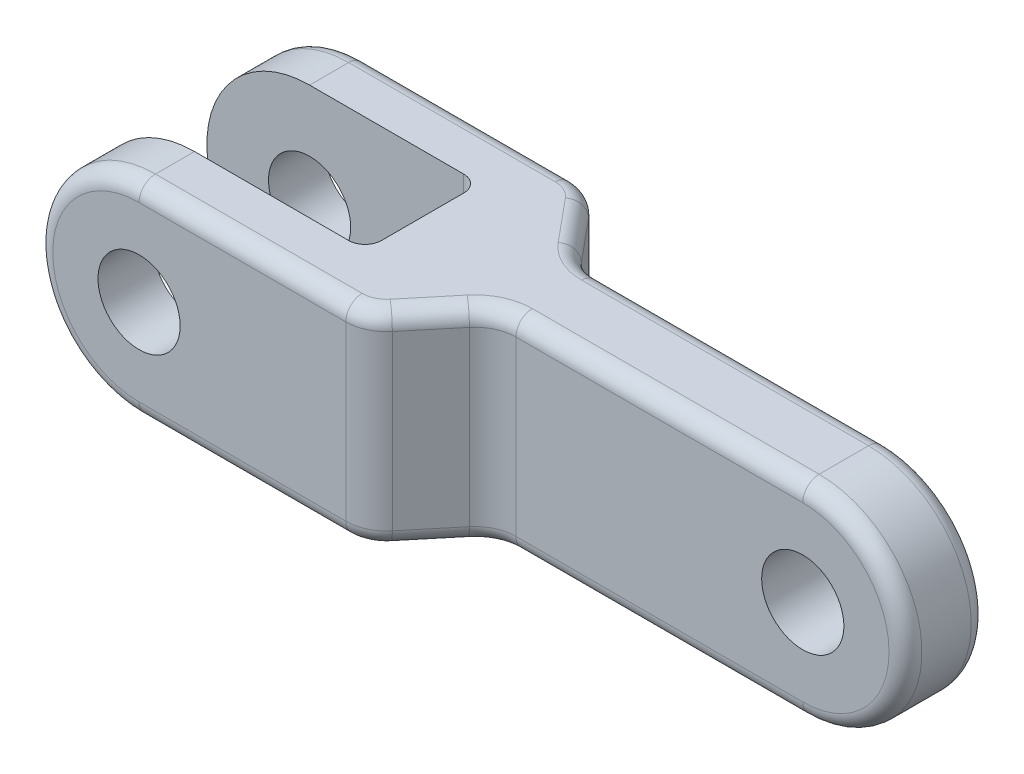
from build123d import *

# Parameters (mm, degrees)
BASE_EXTRUDE_DEPTH  = 13.75
CUT_EXTRUDE1_DEPTH  = 7
BOSS_EXTRUDE1_DEPTH = 5
BOSS_EXTRUDE2_START = -25
BOSS_EXTRUDE2_DEPTH = 25
HOLE1_START         = -13.75
HOLE1_OUTLINE_R     = 5
HOLE1_DEPTH         = 27.5
LPATTERN1_COUNT     = 2
LPATTERN1_PITCH     = 72
FILLET1_R           = 5
FILLET2_R           = 5
FILLET3_R           = 2
FILLET4_R           = 2


# Read off the part's stored shape, not the designer's step: Hole1
with BuildPart() as part:
    # Sketch3 → Base-Extrude (new, symmetric)
    with BuildSketch(Plane.XY):
        with BuildLine():
            Line((0, 12.5), (27.5, 12.5))
            Line((27.5, 12.5), (27.5, -12.5))
            Line((27.5, -12.5), (0, -12.5))
            ThreePointArc((0, -12.5), (-12.5, 0), (0, 12.5))
        make_face()
    extrude(amount=BASE_EXTRUDE_DEPTH, both=True)

    # Sketch5 → Cut-Extrude1 (cut, symmetric)
    with BuildSketch(Plane.XY):
        with BuildLine():
            Line((20.75, 12.5), (20.75, -12.5))
            Line((20.75, -12.5), (0, -12.5))
            ThreePointArc((0, -12.5), (-12.5, 0), (0, 12.5))
            Line((0, 12.5), (20.75, 12.5))
        make_face()
    extrude(amount=CUT_EXTRUDE1_DEPTH, both=True, mode=Mode.SUBTRACT)

    # Sketch6 → Boss-Extrude1 (add, symmetric)
    with BuildSketch(Plane.XY):
        with BuildLine():
            Line((27.5, 12.5), (72, 12.5))
            ThreePointArc((72, 12.5), (84.5, 0), (72, -12.5))
            Line((72, -12.5), (27.5, -12.5))
            Line((27.5, -12.5), (27.5, 12.5))
        make_face()
    extrude(amount=BOSS_EXTRUDE1_DEPTH, both=True)

    # Sketch8 → Boss-Extrude2 (add)
    with BuildSketch(Plane(origin=(0, 12.5, 0), x_dir=(-1, 0, 0), z_dir=(0, 1, 0)).offset(BOSS_EXTRUDE2_START)):
        Polygon((-27.5, 13.75), (-27.5, 5), (-34.75, 5), align=None)
    boss_extrude2 = extrude(amount=BOSS_EXTRUDE2_DEPTH)

    # Mirror1: Boss-Extrude2 across plane
    add(boss_extrude2.mirror(Plane.XY))

    # Hole1 outline → Hole1 (cut)
    with BuildSketch(Plane.XY.offset(HOLE1_START)):
        Circle(HOLE1_OUTLINE_R)
    hole1 = extrude(amount=HOLE1_DEPTH, mode=Mode.SUBTRACT)

    # LPattern1: Hole1 ×2
    with Locations(*[(i * LPATTERN1_PITCH, 0, 0) for i in range(1, LPATTERN1_COUNT)]):
        add(hole1, mode=Mode.SUBTRACT)

    # Fillet1
    fillet1_edges = [part.edges().sort_by_distance(p)[0] for p in [
        (34.75, 0, 5),
        (34.75, 0, -5),
    ]]
    fillet(fillet1_edges, radius=FILLET1_R)

    # Fillet2
    fillet2_edges = [part.edges().sort_by_distance(p)[0] for p in [
        (27.5, 0, 13.75),
        (27.5, 0, -13.75),
    ]]
    fillet(fillet2_edges, radius=FILLET2_R)

    # Fillet3
    fillet3_edges = [part.edges().sort_by_distance(p)[0] for p in [
        (54.550233765, -12.5, 5),
        (84.5, 0, 5),
        (84.5, 0, -5),
        (54.550233765, -12.5, -5),
        (-12.5, 0, 13.75),
        (12.574766235, 12.5, -13.75),
        (-12.5, 0, -13.75),
        (12.574766235, 12.5, 13.75),
        (54.550233765, 12.5, 5),
        (54.550233765, 12.5, -5),
        (34.973315281, 12.5, 5.475044386),
        (34.973315281, -12.5, 5.475044386),
        (34.973315281, 12.5, -5.475044386),
        (34.973315281, -12.5, -5.475044386),
        (31.125, 12.5, -9.375),
        (31.125, -12.5, -9.375),
        (31.125, 12.5, 9.375),
        (27.276684719, 12.5, 13.274955614),
        (27.276684719, 12.5, -13.274955614),
        (12.574766235, -12.5, -13.75),
        (31.125, -12.5, 9.375),
        (12.574766235, -12.5, 13.75),
        (27.276684719, -12.5, 13.274955614),
        (27.276684719, -12.5, -13.274955614),
    ]]
    fillet(fillet3_edges, radius=FILLET3_R)

    # Fillet4
    fillet4_edges = [part.edges().sort_by_distance(p)[0] for p in [
        (20.75, 0, 7),
        (20.75, 0, -7),
    ]]
    fillet(fillet4_edges, radius=FILLET4_R)


solid = part.part
